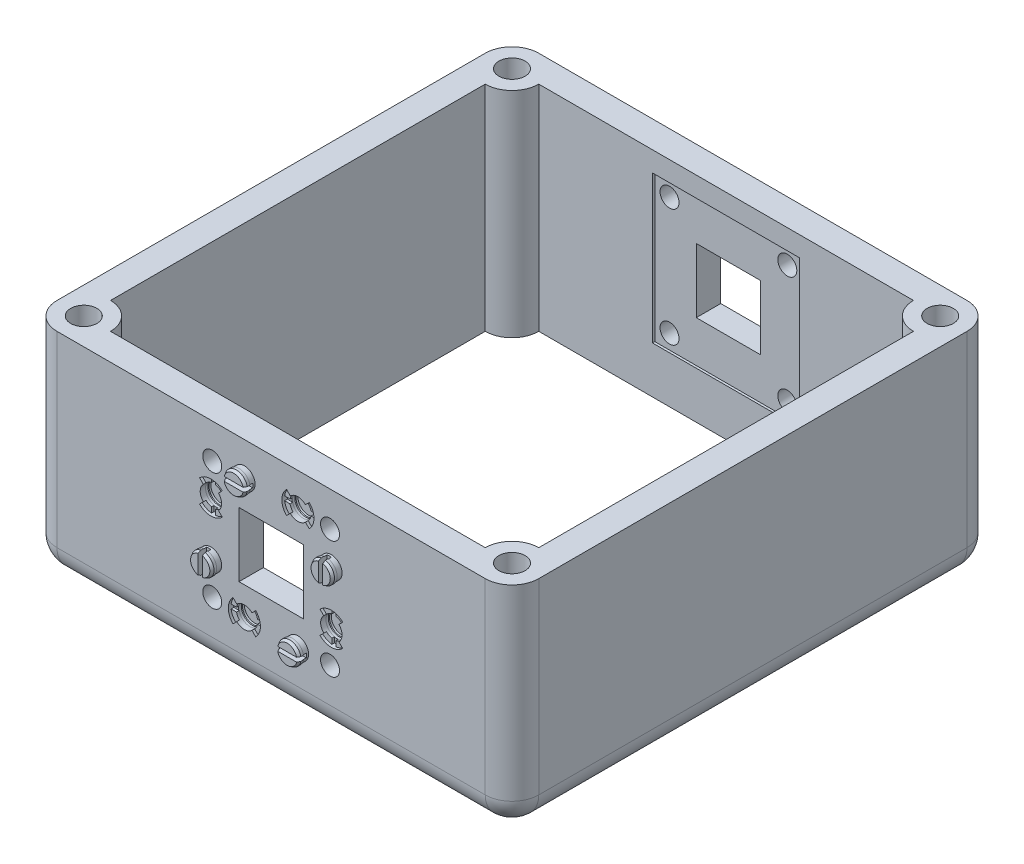
from build123d import *

# Parameters (mm, degrees)
SKETCH1_W                                           = 114.3
SKETCH1_H                                           = 114.3
BOSS_EXTRUDE1_DEPTH                                 = 25.4
CUT_EXTRUDE1_DEPTH                                  = 50.8
CBORE_FOR_0_BINDING_HEAD_MACHINE_SCREW1_D           = 1.8542
CBORE_FOR_0_BINDING_HEAD_MACHINE_SCREW1_DEPTH       = 17.73094212
CBORE_FOR_0_BINDING_HEAD_MACHINE_SCREW1_CBORE_D     = 6.223
CBORE_FOR_0_BINDING_HEAD_MACHINE_SCREW1_CBORE_DEPTH = 9.144
CBORE_FOR_0_BINDING_HEAD_MACHINE_SCREW1_TIP         = 0.55705788
SKETCH5_W                                           = 34.94
SKETCH5_H                                           = 34.94
SKETCH5_W_2                                         = 15.25
SKETCH5_H_2                                         = 15.25
CUT_EXTRUDE5_DEPTH                                  = 0.55
CUT_EXTRUDE6_REACH                                  = 126.758
SKETCH5_3_W                                         = 15.25
SKETCH5_3_H                                         = 15.25
SKETCH13_R                                          = 2.54
BOSS_EXTRUDE2_DEPTH                                 = 1.27
CUT_EXTRUDE7_DEPTH                                  = 2.54
CUT_EXTRUDE8_DEPTH                                  = 0.635
CUT_EXTRUDE9_DEPTH                                  = 1.27
CBORE_FOR_M5_HEX_HEAD_BOLT2_AT_2_COUNT              = 2
CBORE_FOR_M5_HEX_HEAD_BOLT2_AT_2_PITCH              = 27.94
CBORE_FOR_M5_HEX_HEAD_BOLT2_AT_3_COUNT              = 2
CBORE_FOR_M5_HEX_HEAD_BOLT2_AT_3_PITCH              = 39.513126933
CBORE_FOR_M5_HEX_HEAD_BOLT2_AT_4_COUNT              = 2
CBORE_FOR_M5_HEX_HEAD_BOLT2_AT_4_PITCH              = 27.94
CUT_EXTRUDE10_START                                 = -2.032
CUT_EXTRUDE10_DEPTH                                 = 2.032
CIRPATTERN1_COUNT                                   = 4
CIRPATTERN2_COUNT                                   = 2
CIRPATTERN2_ANGLE                                   = 180
CIRPATTERN2_COPY_1_SKETCH_R                         = 2.54
CIRPATTERN2_COPY_1_DEPTH                            = 1.27
CIRPATTERN2_COPY_2_SKETCH_R                         = 2.54
CIRPATTERN2_COPY_2_DEPTH                            = 1.27
CIRPATTERN2_COPY_3_SKETCH_R                         = 2.54
CIRPATTERN2_COPY_3_DEPTH                            = 1.27
CIRPATTERN2_COPY_7_DEPTH                            = 2.54
CIRPATTERN2_COPY_8_DEPTH                            = 2.54
CIRPATTERN2_COPY_9_DEPTH                            = 2.54
CIRPATTERN2_COPY_10_DEPTH                           = 0.635
CIRPATTERN2_COPY_11_DEPTH                           = 0.635
CIRPATTERN2_COPY_12_DEPTH                           = 0.635
CIRPATTERN2_COPY_13_DEPTH                           = 1.27
CIRPATTERN2_COPY_14_DEPTH                           = 1.27
CIRPATTERN2_COPY_15_DEPTH                           = 1.27
CIRPATTERN2_START                                   = -2.032
CIRPATTERN2_COPY_19_DEPTH                           = 2.032
CIRPATTERN2_COPY_20_DEPTH                           = 2.032
CIRPATTERN2_COPY_21_DEPTH                           = 2.032
CIRPATTERN3_COUNT                                   = 2
CIRPATTERN3_ANGLE                                   = 180
FILLET1_R                                           = 6.35


with BuildPart() as part:
    # Sketch1 → Boss-Extrude1 (new, symmetric)
    with BuildSketch(Plane(origin=(0, 0, 0), x_dir=(1, 0, 0), z_dir=(0, 1, 0))):
        Rectangle(SKETCH1_W, SKETCH1_H)
    extrude(amount=BOSS_EXTRUDE1_DEPTH, both=True)

    # Sketch2 → Cut-Extrude1 (cut)
    with BuildSketch(Plane(origin=(0, 25.4, 0), x_dir=(1, 0, 0), z_dir=(0, 1, 0))):
        with BuildLine():
            Line((44.45, 50.8), (-44.45, 50.8))
            ThreePointArc((-44.45, 50.8), (-46.309871939, 46.309871939), (-50.8, 44.45))
            Line((-50.8, 44.45), (-50.8, -44.45))
            ThreePointArc((-50.8, -44.45), (-46.309871939, -46.309871939), (-44.45, -50.8))
            Line((-44.45, -50.8), (44.45, -50.8))
            ThreePointArc((44.45, -50.8), (46.309871939, -46.309871939), (50.8, -44.45))
            Line((50.8, -44.45), (50.8, 44.45))
            ThreePointArc((50.8, 44.45), (46.309871939, 46.309871939), (44.45, 50.8))
        make_face()
    extrude(amount=-CUT_EXTRUDE1_DEPTH, mode=Mode.SUBTRACT)

    # CBORE for #0 Binding Head Machine Screw1
    with Locations(Plane(origin=(-50.8, 25.4, -50.8), x_dir=(0, 0, 1), z_dir=(0, 1, 0))):
        with Locations((0, 0), (0, 101.6), (101.6, 0), (101.6, 101.6)):
            CounterBoreHole(CBORE_FOR_0_BINDING_HEAD_MACHINE_SCREW1_D / 2, CBORE_FOR_0_BINDING_HEAD_MACHINE_SCREW1_CBORE_D / 2, CBORE_FOR_0_BINDING_HEAD_MACHINE_SCREW1_CBORE_DEPTH, depth=CBORE_FOR_0_BINDING_HEAD_MACHINE_SCREW1_DEPTH)
            with Locations((0, 0, -(CBORE_FOR_0_BINDING_HEAD_MACHINE_SCREW1_DEPTH + CBORE_FOR_0_BINDING_HEAD_MACHINE_SCREW1_TIP / 2))):  # 118° drill point
                Cone(0, CBORE_FOR_0_BINDING_HEAD_MACHINE_SCREW1_D / 2, CBORE_FOR_0_BINDING_HEAD_MACHINE_SCREW1_TIP, mode=Mode.SUBTRACT)

    # Sketch5 → Cut-Extrude5 (cut)
    with BuildSketch(Plane.XY.offset(-50.8)):
        with Locations((0, 3.175)):
            Rectangle(SKETCH5_W, SKETCH5_H)
        with Locations((0, 3.175)):
            Rectangle(SKETCH5_W_2, SKETCH5_H_2, mode=Mode.SUBTRACT)
    cut_extrude5 = extrude(amount=-CUT_EXTRUDE5_DEPTH, mode=Mode.SUBTRACT)

    # Sketch5<3> → Cut-Extrude6 (cut, up to next)
    with BuildSketch(Plane.XY.offset(-50.8), mode=Mode.PRIVATE) as cut_extrude6_sk1:
        with Locations((0, 3.175)):
            Rectangle(SKETCH5_3_W, SKETCH5_3_H)
    cut_extrude6_tool1 = extrude(cut_extrude6_sk1.sketch, amount=-CUT_EXTRUDE6_REACH, mode=Mode.PRIVATE) & part.part
    cut_extrude6 = cut_extrude6_tool1.solids().sort_by_distance((0, 3.175, -50.8))[0]
    add(cut_extrude6, mode=Mode.SUBTRACT)

    # Sketch13 → Boss-Extrude2 (add)
    with BuildSketch(Plane(origin=(0, 0, -57.15), x_dir=(-1, 0, 0), z_dir=(0, 0, -1))):
        with Locations(Location((-14.2875, -3.175, 0), (0, 0, 180))):
            Circle(SKETCH13_R)
    boss_extrude2 = extrude(amount=BOSS_EXTRUDE2_DEPTH)

    # Sketch14 → Revolve1 (revolve)
    with BuildSketch(Plane(origin=(14.2875, -3.175, -57.15), x_dir=(-1, 0, 0), z_dir=(0, -1, 0)), mode=Mode.PRIVATE) as revolve1_sk:
        Polygon((0, 1.27), (0, 2.54), (2.286, 2.54), (2.64, 1.905), (2.64, 1.27), (2.54, 1.27), align=None)
    revolve1 = revolve(revolve1_sk.sketch.rotate(Axis((14.2875, -3.175, -58.42), (0, 0, -1)), 180), axis=Axis((14.2875, -3.175, -58.42), (0, 0, -1)))

    # Sketch13<4> → Cut-Extrude7 (cut)
    with BuildSketch(Plane(origin=(0, 0, -57.15), x_dir=(-1, 0, 0), z_dir=(0, 0, -1))):
        with BuildLine():
            Line((16.083551224, -1.378948776), (14.7875, -2.675))
            Line((14.7875, -2.675), (14.7875, -3.675))
            Line((14.7875, -3.675), (16.083551224, -4.971051224))
            ThreePointArc((16.083551224, -4.971051224), (16.634154013, -4.147015918), (16.8275, -3.175))
            ThreePointArc((16.8275, -3.175), (16.634154013, -2.202984082), (16.083551224, -1.378948776))
        make_face()
        with BuildLine():
            Line((16.083551224, -4.971051224), (14.7875, -3.675))
            Line((14.7875, -3.675), (14.7875, -5.665301187))
            ThreePointArc((14.7875, -5.665301187), (15.486857561, -5.414004565), (16.083551224, -4.971051224))
        make_face()
        with BuildLine():
            ThreePointArc((14.7875, -0.684698813), (14.2875, -0.635), (13.7875, -0.684698813))
            Line((13.7875, -0.684698813), (13.7875, -2.675))
            Line((13.7875, -2.675), (14.2875, -3.175))
            Line((14.2875, -3.175), (14.7875, -2.675))
            Line((14.7875, -2.675), (14.7875, -0.684698813))
        make_face()
        with BuildLine():
            Line((14.2875, -3.175), (13.7875, -3.675))
            Line((13.7875, -3.675), (13.7875, -5.665301187))
            ThreePointArc((13.7875, -5.665301187), (14.2875, -5.715), (14.7875, -5.665301187))
            Line((14.7875, -5.665301187), (14.7875, -3.675))
            Line((14.7875, -3.675), (14.2875, -3.175))
        make_face()
        with BuildLine():
            ThreePointArc((16.083551224, -1.378948776), (15.486857561, -0.935995435), (14.7875, -0.684698813))
            Line((14.7875, -0.684698813), (14.7875, -2.675))
            Line((14.7875, -2.675), (16.083551224, -1.378948776))
        make_face()
        Polygon((14.7875, -2.675), (14.2875, -3.175), (14.7875, -3.675), align=None)
        Polygon((14.2875, -3.175), (13.7875, -2.675), (13.7875, -3.675), align=None)
        with BuildLine():
            Line((13.7875, -3.675), (13.7875, -2.675))
            Line((13.7875, -2.675), (12.491448776, -1.378948776))
            ThreePointArc((12.491448776, -1.378948776), (11.7475, -3.175), (12.491448776, -4.971051224))
            Line((12.491448776, -4.971051224), (13.7875, -3.675))
        make_face()
        with BuildLine():
            Line((13.7875, -5.665301187), (13.7875, -3.675))
            Line((13.7875, -3.675), (12.491448776, -4.971051224))
            ThreePointArc((12.491448776, -4.971051224), (13.088142439, -5.414004565), (13.7875, -5.665301187))
        make_face()
        with BuildLine():
            Line((13.7875, -2.675), (13.7875, -0.684698813))
            ThreePointArc((13.7875, -0.684698813), (13.088142439, -0.935995435), (12.491448776, -1.378948776))
            Line((12.491448776, -1.378948776), (13.7875, -2.675))
        make_face()
    cut_extrude7 = extrude(amount=-CUT_EXTRUDE7_DEPTH, mode=Mode.SUBTRACT)

    # Sketch13<5> → Cut-Extrude8 (cut)
    with BuildSketch(Plane(origin=(0, 0, -57.15), x_dir=(-1, 0, 0), z_dir=(0, 0, -1))):
        with BuildLine():
            Line((12.491448776, -4.971051224), (11.593423164, -5.869076836))
            ThreePointArc((11.593423164, -5.869076836), (12.601161082, -6.591483726), (13.7875, -6.952049113))
            Line((13.7875, -6.952049113), (13.7875, -5.665301187))
            ThreePointArc((13.7875, -5.665301187), (13.088142439, -5.414004565), (12.491448776, -4.971051224))
        make_face()
        with BuildLine():
            ThreePointArc((14.7875, -6.952049113), (15.973838918, -6.591483726), (16.981576836, -5.869076836))
            Line((16.981576836, -5.869076836), (16.083551224, -4.971051224))
            ThreePointArc((16.083551224, -4.971051224), (15.486857561, -5.414004565), (14.7875, -5.665301187))
            Line((14.7875, -5.665301187), (14.7875, -6.952049113))
        make_face()
        with BuildLine():
            ThreePointArc((16.981576836, -0.480923164), (15.973838918, 0.241483726), (14.7875, 0.602049113))
            Line((14.7875, 0.602049113), (14.7875, -0.684698813))
            ThreePointArc((14.7875, -0.684698813), (15.486857561, -0.935995435), (16.083551224, -1.378948776))
            Line((16.083551224, -1.378948776), (16.981576836, -0.480923164))
        make_face()
        with BuildLine():
            Line((13.7875, -0.684698813), (13.7875, 0.602049113))
            ThreePointArc((13.7875, 0.602049113), (12.601161082, 0.241483726), (11.593423164, -0.480923164))
            Line((11.593423164, -0.480923164), (12.491448776, -1.378948776))
            ThreePointArc((12.491448776, -1.378948776), (13.088142439, -0.935995435), (13.7875, -0.684698813))
        make_face()
    cut_extrude8 = extrude(amount=-CUT_EXTRUDE8_DEPTH, mode=Mode.SUBTRACT)

    # Sketch13<6> → Cut-Extrude9 (cut)
    with BuildSketch(Plane(origin=(0, 0, -57.15), x_dir=(-1, 0, 0), z_dir=(0, 0, -1))):
        with BuildLine():
            ThreePointArc((14.7875, 0.602049113), (14.2875, 0.635), (13.7875, 0.602049113))
            Line((13.7875, 0.602049113), (13.7875, -0.684698813))
            ThreePointArc((13.7875, -0.684698813), (14.2875, -0.635), (14.7875, -0.684698813))
            Line((14.7875, -0.684698813), (14.7875, 0.602049113))
        make_face()
        with BuildLine():
            Line((13.7875, -5.665301187), (13.7875, -6.952049113))
            ThreePointArc((13.7875, -6.952049113), (14.2875, -6.985), (14.7875, -6.952049113))
            Line((14.7875, -6.952049113), (14.7875, -5.665301187))
            ThreePointArc((14.7875, -5.665301187), (14.2875, -5.715), (13.7875, -5.665301187))
        make_face()
    cut_extrude9 = extrude(amount=-CUT_EXTRUDE9_DEPTH, mode=Mode.SUBTRACT)

    # Sketch17 → Cut-Revolve1 (revolve, cut)
    with BuildSketch(Plane(origin=(-14.2875, -3.175, -57.15), x_dir=(-1, 0, 0), z_dir=(0, -1, 0))):
        Polygon((0, -1.27), (0, -2.54), (2.286, -2.54), (2.64, -1.905), (2.64, -1.27), (2.54, -1.27), align=None)
    cut_revolve1 = revolve(axis=Axis((-14.2875, -3.175, -55.88), (0, 0, 1)), mode=Mode.SUBTRACT)

    # Sketch21 → CBORE for M5 Hex Head Bolt2 (revolve, cut)
    with BuildSketch(Plane(origin=(13.97, 17.145, -57.15), x_dir=(0, 1, 0), z_dir=(1, 0, 0))):
        Polygon((0, 0), (0, 18.288), (2.75, 16.635633298), (2.75, 5.8), (2.25, 5.8), (2.25, 0), align=None)
    cbore_for_m5_hex_head_bolt2 = revolve(axis=Axis((13.97, 17.145, -63.5), (0, 0, 1)), mode=Mode.SUBTRACT)

    # CBORE for M5 Hex Head Bolt2 at 2: CBORE for M5 Hex Head Bolt2 ×2
    with Locations(*[(-i * CBORE_FOR_M5_HEX_HEAD_BOLT2_AT_2_PITCH, 0, 0) for i in range(1, CBORE_FOR_M5_HEX_HEAD_BOLT2_AT_2_COUNT)]):
        add(cbore_for_m5_hex_head_bolt2, mode=Mode.SUBTRACT)

    # CBORE for M5 Hex Head Bolt2 at 3: CBORE for M5 Hex Head Bolt2 ×2
    with Locations(*[Vector(-0.7071067811865476, -0.7071067811865476, 0) * (i * CBORE_FOR_M5_HEX_HEAD_BOLT2_AT_3_PITCH) for i in range(1, CBORE_FOR_M5_HEX_HEAD_BOLT2_AT_3_COUNT)]):
        add(cbore_for_m5_hex_head_bolt2, mode=Mode.SUBTRACT)

    # CBORE for M5 Hex Head Bolt2 at 4: CBORE for M5 Hex Head Bolt2 ×2
    with Locations(*[(0, -i * CBORE_FOR_M5_HEX_HEAD_BOLT2_AT_4_PITCH, 0) for i in range(1, CBORE_FOR_M5_HEX_HEAD_BOLT2_AT_4_COUNT)]):
        add(cbore_for_m5_hex_head_bolt2, mode=Mode.SUBTRACT)

    # Sketch23 → Cut-Extrude10 (cut)
    with BuildSketch(Plane(origin=(0, 0, -59.69), x_dir=(-1, 0, 0), z_dir=(0, 0, -1)).offset(CUT_EXTRUDE10_START)):
        with BuildLine():
            ThreePointArc((-14.2875, -0.889), (-14.539027189, -0.902879829), (-14.7875, -0.944350767))
            Line((-14.7875, -0.944350767), (-14.7875, -5.405649233))
            ThreePointArc((-14.7875, -5.405649233), (-14.539027189, -5.447120171), (-14.2875, -5.461))
            Line((-14.2875, -5.461), (-14.2875, -0.889))
        make_face()
        with BuildLine():
            ThreePointArc((-13.7875, -0.944350767), (-14.035972811, -0.902879829), (-14.2875, -0.889))
            Line((-14.2875, -0.889), (-14.2875, -5.461))
            ThreePointArc((-14.2875, -5.461), (-14.035972811, -5.447120171), (-13.7875, -5.405649233))
            Line((-13.7875, -5.405649233), (-13.7875, -0.944350767))
        make_face()
        with BuildLine():
            ThreePointArc((-14.2875, -0.535), (-14.538638912, -0.546972366), (-14.7875, -0.582780873))
            Line((-14.7875, -0.582780873), (-14.7875, -0.944350767))
            ThreePointArc((-14.7875, -0.944350767), (-14.539027189, -0.902879829), (-14.2875, -0.889))
            Line((-14.2875, -0.889), (-14.2875, -0.535))
        make_face()
        with BuildLine():
            Line((-14.7875, -5.405649233), (-14.7875, -5.767219127))
            ThreePointArc((-14.7875, -5.767219127), (-14.538638912, -5.803027634), (-14.2875, -5.815))
            Line((-14.2875, -5.815), (-14.2875, -5.461))
            ThreePointArc((-14.2875, -5.461), (-14.539027189, -5.447120171), (-14.7875, -5.405649233))
        make_face()
        with BuildLine():
            ThreePointArc((-13.7875, -0.582780873), (-14.036361088, -0.546972366), (-14.2875, -0.535))
            Line((-14.2875, -0.535), (-14.2875, -0.889))
            ThreePointArc((-14.2875, -0.889), (-14.035972811, -0.902879829), (-13.7875, -0.944350767))
            Line((-13.7875, -0.944350767), (-13.7875, -0.582780873))
        make_face()
        with BuildLine():
            Line((-14.2875, -5.461), (-14.2875, -5.815))
            ThreePointArc((-14.2875, -5.815), (-14.036361088, -5.803027634), (-13.7875, -5.767219127))
            Line((-13.7875, -5.767219127), (-13.7875, -5.405649233))
            ThreePointArc((-13.7875, -5.405649233), (-14.035972811, -5.447120171), (-14.2875, -5.461))
        make_face()
    cut_extrude10 = extrude(amount=CUT_EXTRUDE10_DEPTH, mode=Mode.SUBTRACT)

    # CirPattern1: Boss-Extrude2, Revolve1, Cut-Extrude7, Cut-Extrude8, Cut-Extrude9, Cut-Revolve1, Cut-Extrude10 ×4 about axis
    cirpattern1_axis = Axis((0, 3.175, 0), (0, 0, 1))
    add([boss_extrude2.rotate(cirpattern1_axis, i * 360 / CIRPATTERN1_COUNT) for i in range(1, CIRPATTERN1_COUNT)])
    add([revolve1.rotate(cirpattern1_axis, i * 360 / CIRPATTERN1_COUNT) for i in range(1, CIRPATTERN1_COUNT)])
    add([cut_extrude7.rotate(cirpattern1_axis, i * 360 / CIRPATTERN1_COUNT) for i in range(1, CIRPATTERN1_COUNT)], mode=Mode.SUBTRACT)
    add([cut_extrude8.rotate(cirpattern1_axis, i * 360 / CIRPATTERN1_COUNT) for i in range(1, CIRPATTERN1_COUNT)], mode=Mode.SUBTRACT)
    add([cut_extrude9.rotate(cirpattern1_axis, i * 360 / CIRPATTERN1_COUNT) for i in range(1, CIRPATTERN1_COUNT)], mode=Mode.SUBTRACT)
    add([cut_revolve1.rotate(cirpattern1_axis, i * 360 / CIRPATTERN1_COUNT) for i in range(1, CIRPATTERN1_COUNT)], mode=Mode.SUBTRACT)
    add([cut_extrude10.rotate(cirpattern1_axis, i * 360 / CIRPATTERN1_COUNT) for i in range(1, CIRPATTERN1_COUNT)], mode=Mode.SUBTRACT)

    # CirPattern2: Boss-Extrude2, Revolve1, Cut-Extrude7, Cut-Extrude8, Cut-Extrude9, Cut-Revolve1, Cut-Extrude10 ×2 about axis
    cirpattern2_axis = Axis((0, 3.175, 0), (1, 0, 0))
    add([boss_extrude2.rotate(cirpattern2_axis, i * CIRPATTERN2_ANGLE / (CIRPATTERN2_COUNT - 1)) for i in range(1, CIRPATTERN2_COUNT)])
    add([revolve1.rotate(cirpattern2_axis, i * CIRPATTERN2_ANGLE / (CIRPATTERN2_COUNT - 1)) for i in range(1, CIRPATTERN2_COUNT)])
    add([cut_extrude7.rotate(cirpattern2_axis, i * CIRPATTERN2_ANGLE / (CIRPATTERN2_COUNT - 1)) for i in range(1, CIRPATTERN2_COUNT)], mode=Mode.SUBTRACT)
    add([cut_extrude8.rotate(cirpattern2_axis, i * CIRPATTERN2_ANGLE / (CIRPATTERN2_COUNT - 1)) for i in range(1, CIRPATTERN2_COUNT)], mode=Mode.SUBTRACT)
    add([cut_extrude9.rotate(cirpattern2_axis, i * CIRPATTERN2_ANGLE / (CIRPATTERN2_COUNT - 1)) for i in range(1, CIRPATTERN2_COUNT)], mode=Mode.SUBTRACT)
    add([cut_revolve1.rotate(cirpattern2_axis, i * CIRPATTERN2_ANGLE / (CIRPATTERN2_COUNT - 1)) for i in range(1, CIRPATTERN2_COUNT)], mode=Mode.SUBTRACT)
    add([cut_extrude10.rotate(cirpattern2_axis, i * CIRPATTERN2_ANGLE / (CIRPATTERN2_COUNT - 1)) for i in range(1, CIRPATTERN2_COUNT)], mode=Mode.SUBTRACT)

    # CirPattern2 copy 1 sketch → CirPattern2 copy 1 (add)
    with BuildSketch(Plane(origin=(3.175, 3.175, 57.15), x_dir=(0, 1, 0), z_dir=(0, 0, 1))):
        with Locations(Location((-14.2875, -3.175, 0), (0, 0, 180))):
            Circle(CIRPATTERN2_COPY_1_SKETCH_R)
    extrude(amount=CIRPATTERN2_COPY_1_DEPTH)

    # CirPattern2 copy 2 sketch → CirPattern2 copy 2 (add)
    with BuildSketch(Plane.XY.offset(57.15)):
        with Locations(Location((-14.2875, -3.175, 0), (0, 0, 180))):
            Circle(CIRPATTERN2_COPY_2_SKETCH_R)
    extrude(amount=CIRPATTERN2_COPY_2_DEPTH)

    # CirPattern2 copy 3 sketch → CirPattern2 copy 3 (add)
    with BuildSketch(Plane(origin=(-3.175, 3.175, 57.15), x_dir=(0, -1, 0), z_dir=(0, 0, 1))):
        with Locations(Location((-14.2875, -3.175, 0), (0, 0, 180))):
            Circle(CIRPATTERN2_COPY_3_SKETCH_R)
    extrude(amount=CIRPATTERN2_COPY_3_DEPTH)

    # CirPattern2 copy 4 sketch → CirPattern2 copy 4 (revolve)
    with BuildSketch(Plane(origin=(6.35, -11.1125, 57.15), x_dir=(0, 1, 0), z_dir=(1, 0, 0))):
        Polygon((0, 1.27), (0, 2.54), (2.286, 2.54), (2.64, 1.905), (2.64, 1.27), (2.54, 1.27), align=None)
    revolve(axis=Axis((6.35, -11.1125, 58.42), (0, 0, 1)))

    # CirPattern2 copy 5 sketch → CirPattern2 copy 5 (revolve)
    with BuildSketch(Plane(origin=(-14.2875, -3.175, 57.15), x_dir=(1, 0, 0), z_dir=(0, -1, 0))):
        Polygon((0, 1.27), (0, 2.54), (2.286, 2.54), (2.64, 1.905), (2.64, 1.27), (2.54, 1.27), align=None)
    revolve(axis=Axis((-14.2875, -3.175, 58.42), (0, 0, 1)))

    # CirPattern2 copy 6 sketch → CirPattern2 copy 6 (revolve)
    with BuildSketch(Plane(origin=(-6.35, 17.4625, 57.15), x_dir=(0, -1, 0), z_dir=(-1, 0, 0))):
        Polygon((0, 1.27), (0, 2.54), (2.286, 2.54), (2.64, 1.905), (2.64, 1.27), (2.54, 1.27), align=None)
    revolve(axis=Axis((-6.35, 17.4625, 58.42), (0, 0, 1)))

    # CirPattern2 copy 7 sketch → CirPattern2 copy 7 (cut)
    with BuildSketch(Plane(origin=(3.175, 3.175, 57.15), x_dir=(0, 1, 0), z_dir=(0, 0, 1))):
        with BuildLine():
            Line((16.083551224, -1.378948776), (14.7875, -2.675))
            Line((14.7875, -2.675), (14.7875, -3.675))
            Line((14.7875, -3.675), (16.083551224, -4.971051224))
            ThreePointArc((16.083551224, -4.971051224), (16.634154013, -4.147015918), (16.8275, -3.175))
            ThreePointArc((16.8275, -3.175), (16.634154013, -2.202984082), (16.083551224, -1.378948776))
        make_face()
        with BuildLine():
            Line((16.083551224, -4.971051224), (14.7875, -3.675))
            Line((14.7875, -3.675), (14.7875, -5.665301187))
            ThreePointArc((14.7875, -5.665301187), (15.486857561, -5.414004565), (16.083551224, -4.971051224))
        make_face()
        with BuildLine():
            ThreePointArc((14.7875, -0.684698813), (14.2875, -0.635), (13.7875, -0.684698813))
            Line((13.7875, -0.684698813), (13.7875, -2.675))
            Line((13.7875, -2.675), (14.2875, -3.175))
            Line((14.2875, -3.175), (14.7875, -2.675))
            Line((14.7875, -2.675), (14.7875, -0.684698813))
        make_face()
        with BuildLine():
            Line((14.2875, -3.175), (13.7875, -3.675))
            Line((13.7875, -3.675), (13.7875, -5.665301187))
            ThreePointArc((13.7875, -5.665301187), (14.2875, -5.715), (14.7875, -5.665301187))
            Line((14.7875, -5.665301187), (14.7875, -3.675))
            Line((14.7875, -3.675), (14.2875, -3.175))
        make_face()
        with BuildLine():
            ThreePointArc((16.083551224, -1.378948776), (15.486857561, -0.935995435), (14.7875, -0.684698813))
            Line((14.7875, -0.684698813), (14.7875, -2.675))
            Line((14.7875, -2.675), (16.083551224, -1.378948776))
        make_face()
        Polygon((14.7875, -2.675), (14.2875, -3.175), (14.7875, -3.675), align=None)
        Polygon((14.2875, -3.175), (13.7875, -2.675), (13.7875, -3.675), align=None)
        with BuildLine():
            Line((13.7875, -3.675), (13.7875, -2.675))
            Line((13.7875, -2.675), (12.491448776, -1.378948776))
            ThreePointArc((12.491448776, -1.378948776), (11.7475, -3.175), (12.491448776, -4.971051224))
            Line((12.491448776, -4.971051224), (13.7875, -3.675))
        make_face()
        with BuildLine():
            Line((13.7875, -5.665301187), (13.7875, -3.675))
            Line((13.7875, -3.675), (12.491448776, -4.971051224))
            ThreePointArc((12.491448776, -4.971051224), (13.088142439, -5.414004565), (13.7875, -5.665301187))
        make_face()
        with BuildLine():
            Line((13.7875, -2.675), (13.7875, -0.684698813))
            ThreePointArc((13.7875, -0.684698813), (13.088142439, -0.935995435), (12.491448776, -1.378948776))
            Line((12.491448776, -1.378948776), (13.7875, -2.675))
        make_face()
    extrude(amount=-CIRPATTERN2_COPY_7_DEPTH, mode=Mode.SUBTRACT)

    # CirPattern2 copy 8 sketch → CirPattern2 copy 8 (cut)
    with BuildSketch(Plane.XY.offset(57.15)):
        with BuildLine():
            Line((16.083551224, -1.378948776), (14.7875, -2.675))
            Line((14.7875, -2.675), (14.7875, -3.675))
            Line((14.7875, -3.675), (16.083551224, -4.971051224))
            ThreePointArc((16.083551224, -4.971051224), (16.634154013, -4.147015918), (16.8275, -3.175))
            ThreePointArc((16.8275, -3.175), (16.634154013, -2.202984082), (16.083551224, -1.378948776))
        make_face()
        with BuildLine():
            Line((16.083551224, -4.971051224), (14.7875, -3.675))
            Line((14.7875, -3.675), (14.7875, -5.665301187))
            ThreePointArc((14.7875, -5.665301187), (15.486857561, -5.414004565), (16.083551224, -4.971051224))
        make_face()
        with BuildLine():
            ThreePointArc((14.7875, -0.684698813), (14.2875, -0.635), (13.7875, -0.684698813))
            Line((13.7875, -0.684698813), (13.7875, -2.675))
            Line((13.7875, -2.675), (14.2875, -3.175))
            Line((14.2875, -3.175), (14.7875, -2.675))
            Line((14.7875, -2.675), (14.7875, -0.684698813))
        make_face()
        with BuildLine():
            Line((14.2875, -3.175), (13.7875, -3.675))
            Line((13.7875, -3.675), (13.7875, -5.665301187))
            ThreePointArc((13.7875, -5.665301187), (14.2875, -5.715), (14.7875, -5.665301187))
            Line((14.7875, -5.665301187), (14.7875, -3.675))
            Line((14.7875, -3.675), (14.2875, -3.175))
        make_face()
        with BuildLine():
            ThreePointArc((16.083551224, -1.378948776), (15.486857561, -0.935995435), (14.7875, -0.684698813))
            Line((14.7875, -0.684698813), (14.7875, -2.675))
            Line((14.7875, -2.675), (16.083551224, -1.378948776))
        make_face()
        Polygon((14.7875, -2.675), (14.2875, -3.175), (14.7875, -3.675), align=None)
        Polygon((14.2875, -3.175), (13.7875, -2.675), (13.7875, -3.675), align=None)
        with BuildLine():
            Line((13.7875, -3.675), (13.7875, -2.675))
            Line((13.7875, -2.675), (12.491448776, -1.378948776))
            ThreePointArc((12.491448776, -1.378948776), (11.7475, -3.175), (12.491448776, -4.971051224))
            Line((12.491448776, -4.971051224), (13.7875, -3.675))
        make_face()
        with BuildLine():
            Line((13.7875, -5.665301187), (13.7875, -3.675))
            Line((13.7875, -3.675), (12.491448776, -4.971051224))
            ThreePointArc((12.491448776, -4.971051224), (13.088142439, -5.414004565), (13.7875, -5.665301187))
        make_face()
        with BuildLine():
            Line((13.7875, -2.675), (13.7875, -0.684698813))
            ThreePointArc((13.7875, -0.684698813), (13.088142439, -0.935995435), (12.491448776, -1.378948776))
            Line((12.491448776, -1.378948776), (13.7875, -2.675))
        make_face()
    extrude(amount=-CIRPATTERN2_COPY_8_DEPTH, mode=Mode.SUBTRACT)

    # CirPattern2 copy 9 sketch → CirPattern2 copy 9 (cut)
    with BuildSketch(Plane(origin=(-3.175, 3.175, 57.15), x_dir=(0, -1, 0), z_dir=(0, 0, 1))):
        with BuildLine():
            Line((16.083551224, -1.378948776), (14.7875, -2.675))
            Line((14.7875, -2.675), (14.7875, -3.675))
            Line((14.7875, -3.675), (16.083551224, -4.971051224))
            ThreePointArc((16.083551224, -4.971051224), (16.634154013, -4.147015918), (16.8275, -3.175))
            ThreePointArc((16.8275, -3.175), (16.634154013, -2.202984082), (16.083551224, -1.378948776))
        make_face()
        with BuildLine():
            Line((16.083551224, -4.971051224), (14.7875, -3.675))
            Line((14.7875, -3.675), (14.7875, -5.665301187))
            ThreePointArc((14.7875, -5.665301187), (15.486857561, -5.414004565), (16.083551224, -4.971051224))
        make_face()
        with BuildLine():
            ThreePointArc((14.7875, -0.684698813), (14.2875, -0.635), (13.7875, -0.684698813))
            Line((13.7875, -0.684698813), (13.7875, -2.675))
            Line((13.7875, -2.675), (14.2875, -3.175))
            Line((14.2875, -3.175), (14.7875, -2.675))
            Line((14.7875, -2.675), (14.7875, -0.684698813))
        make_face()
        with BuildLine():
            Line((14.2875, -3.175), (13.7875, -3.675))
            Line((13.7875, -3.675), (13.7875, -5.665301187))
            ThreePointArc((13.7875, -5.665301187), (14.2875, -5.715), (14.7875, -5.665301187))
            Line((14.7875, -5.665301187), (14.7875, -3.675))
            Line((14.7875, -3.675), (14.2875, -3.175))
        make_face()
        with BuildLine():
            ThreePointArc((16.083551224, -1.378948776), (15.486857561, -0.935995435), (14.7875, -0.684698813))
            Line((14.7875, -0.684698813), (14.7875, -2.675))
            Line((14.7875, -2.675), (16.083551224, -1.378948776))
        make_face()
        Polygon((14.7875, -2.675), (14.2875, -3.175), (14.7875, -3.675), align=None)
        Polygon((14.2875, -3.175), (13.7875, -2.675), (13.7875, -3.675), align=None)
        with BuildLine():
            Line((13.7875, -3.675), (13.7875, -2.675))
            Line((13.7875, -2.675), (12.491448776, -1.378948776))
            ThreePointArc((12.491448776, -1.378948776), (11.7475, -3.175), (12.491448776, -4.971051224))
            Line((12.491448776, -4.971051224), (13.7875, -3.675))
        make_face()
        with BuildLine():
            Line((13.7875, -5.665301187), (13.7875, -3.675))
            Line((13.7875, -3.675), (12.491448776, -4.971051224))
            ThreePointArc((12.491448776, -4.971051224), (13.088142439, -5.414004565), (13.7875, -5.665301187))
        make_face()
        with BuildLine():
            Line((13.7875, -2.675), (13.7875, -0.684698813))
            ThreePointArc((13.7875, -0.684698813), (13.088142439, -0.935995435), (12.491448776, -1.378948776))
            Line((12.491448776, -1.378948776), (13.7875, -2.675))
        make_face()
    extrude(amount=-CIRPATTERN2_COPY_9_DEPTH, mode=Mode.SUBTRACT)

    # CirPattern2 copy 10 sketch → CirPattern2 copy 10 (cut)
    with BuildSketch(Plane(origin=(3.175, 3.175, 57.15), x_dir=(0, 1, 0), z_dir=(0, 0, 1))):
        with BuildLine():
            Line((12.491448776, -4.971051224), (11.593423164, -5.869076836))
            ThreePointArc((11.593423164, -5.869076836), (12.601161082, -6.591483726), (13.7875, -6.952049113))
            Line((13.7875, -6.952049113), (13.7875, -5.665301187))
            ThreePointArc((13.7875, -5.665301187), (13.088142439, -5.414004565), (12.491448776, -4.971051224))
        make_face()
        with BuildLine():
            ThreePointArc((14.7875, -6.952049113), (15.973838918, -6.591483726), (16.981576836, -5.869076836))
            Line((16.981576836, -5.869076836), (16.083551224, -4.971051224))
            ThreePointArc((16.083551224, -4.971051224), (15.486857561, -5.414004565), (14.7875, -5.665301187))
            Line((14.7875, -5.665301187), (14.7875, -6.952049113))
        make_face()
        with BuildLine():
            ThreePointArc((16.981576836, -0.480923164), (15.973838918, 0.241483726), (14.7875, 0.602049113))
            Line((14.7875, 0.602049113), (14.7875, -0.684698813))
            ThreePointArc((14.7875, -0.684698813), (15.486857561, -0.935995435), (16.083551224, -1.378948776))
            Line((16.083551224, -1.378948776), (16.981576836, -0.480923164))
        make_face()
        with BuildLine():
            Line((13.7875, -0.684698813), (13.7875, 0.602049113))
            ThreePointArc((13.7875, 0.602049113), (12.601161082, 0.241483726), (11.593423164, -0.480923164))
            Line((11.593423164, -0.480923164), (12.491448776, -1.378948776))
            ThreePointArc((12.491448776, -1.378948776), (13.088142439, -0.935995435), (13.7875, -0.684698813))
        make_face()
    extrude(amount=-CIRPATTERN2_COPY_10_DEPTH, mode=Mode.SUBTRACT)

    # CirPattern2 copy 11 sketch → CirPattern2 copy 11 (cut)
    with BuildSketch(Plane.XY.offset(57.15)):
        with BuildLine():
            Line((12.491448776, -4.971051224), (11.593423164, -5.869076836))
            ThreePointArc((11.593423164, -5.869076836), (12.601161082, -6.591483726), (13.7875, -6.952049113))
            Line((13.7875, -6.952049113), (13.7875, -5.665301187))
            ThreePointArc((13.7875, -5.665301187), (13.088142439, -5.414004565), (12.491448776, -4.971051224))
        make_face()
        with BuildLine():
            ThreePointArc((14.7875, -6.952049113), (15.973838918, -6.591483726), (16.981576836, -5.869076836))
            Line((16.981576836, -5.869076836), (16.083551224, -4.971051224))
            ThreePointArc((16.083551224, -4.971051224), (15.486857561, -5.414004565), (14.7875, -5.665301187))
            Line((14.7875, -5.665301187), (14.7875, -6.952049113))
        make_face()
        with BuildLine():
            ThreePointArc((16.981576836, -0.480923164), (15.973838918, 0.241483726), (14.7875, 0.602049113))
            Line((14.7875, 0.602049113), (14.7875, -0.684698813))
            ThreePointArc((14.7875, -0.684698813), (15.486857561, -0.935995435), (16.083551224, -1.378948776))
            Line((16.083551224, -1.378948776), (16.981576836, -0.480923164))
        make_face()
        with BuildLine():
            Line((13.7875, -0.684698813), (13.7875, 0.602049113))
            ThreePointArc((13.7875, 0.602049113), (12.601161082, 0.241483726), (11.593423164, -0.480923164))
            Line((11.593423164, -0.480923164), (12.491448776, -1.378948776))
            ThreePointArc((12.491448776, -1.378948776), (13.088142439, -0.935995435), (13.7875, -0.684698813))
        make_face()
    extrude(amount=-CIRPATTERN2_COPY_11_DEPTH, mode=Mode.SUBTRACT)

    # CirPattern2 copy 12 sketch → CirPattern2 copy 12 (cut)
    with BuildSketch(Plane(origin=(-3.175, 3.175, 57.15), x_dir=(0, -1, 0), z_dir=(0, 0, 1))):
        with BuildLine():
            Line((12.491448776, -4.971051224), (11.593423164, -5.869076836))
            ThreePointArc((11.593423164, -5.869076836), (12.601161082, -6.591483726), (13.7875, -6.952049113))
            Line((13.7875, -6.952049113), (13.7875, -5.665301187))
            ThreePointArc((13.7875, -5.665301187), (13.088142439, -5.414004565), (12.491448776, -4.971051224))
        make_face()
        with BuildLine():
            ThreePointArc((14.7875, -6.952049113), (15.973838918, -6.591483726), (16.981576836, -5.869076836))
            Line((16.981576836, -5.869076836), (16.083551224, -4.971051224))
            ThreePointArc((16.083551224, -4.971051224), (15.486857561, -5.414004565), (14.7875, -5.665301187))
            Line((14.7875, -5.665301187), (14.7875, -6.952049113))
        make_face()
        with BuildLine():
            ThreePointArc((16.981576836, -0.480923164), (15.973838918, 0.241483726), (14.7875, 0.602049113))
            Line((14.7875, 0.602049113), (14.7875, -0.684698813))
            ThreePointArc((14.7875, -0.684698813), (15.486857561, -0.935995435), (16.083551224, -1.378948776))
            Line((16.083551224, -1.378948776), (16.981576836, -0.480923164))
        make_face()
        with BuildLine():
            Line((13.7875, -0.684698813), (13.7875, 0.602049113))
            ThreePointArc((13.7875, 0.602049113), (12.601161082, 0.241483726), (11.593423164, -0.480923164))
            Line((11.593423164, -0.480923164), (12.491448776, -1.378948776))
            ThreePointArc((12.491448776, -1.378948776), (13.088142439, -0.935995435), (13.7875, -0.684698813))
        make_face()
    extrude(amount=-CIRPATTERN2_COPY_12_DEPTH, mode=Mode.SUBTRACT)

    # CirPattern2 copy 13 sketch → CirPattern2 copy 13 (cut)
    with BuildSketch(Plane(origin=(3.175, 3.175, 57.15), x_dir=(0, 1, 0), z_dir=(0, 0, 1))):
        with BuildLine():
            ThreePointArc((14.7875, 0.602049113), (14.2875, 0.635), (13.7875, 0.602049113))
            Line((13.7875, 0.602049113), (13.7875, -0.684698813))
            ThreePointArc((13.7875, -0.684698813), (14.2875, -0.635), (14.7875, -0.684698813))
            Line((14.7875, -0.684698813), (14.7875, 0.602049113))
        make_face()
        with BuildLine():
            Line((13.7875, -5.665301187), (13.7875, -6.952049113))
            ThreePointArc((13.7875, -6.952049113), (14.2875, -6.985), (14.7875, -6.952049113))
            Line((14.7875, -6.952049113), (14.7875, -5.665301187))
            ThreePointArc((14.7875, -5.665301187), (14.2875, -5.715), (13.7875, -5.665301187))
        make_face()
    extrude(amount=-CIRPATTERN2_COPY_13_DEPTH, mode=Mode.SUBTRACT)

    # CirPattern2 copy 14 sketch → CirPattern2 copy 14 (cut)
    with BuildSketch(Plane.XY.offset(57.15)):
        with BuildLine():
            ThreePointArc((14.7875, 0.602049113), (14.2875, 0.635), (13.7875, 0.602049113))
            Line((13.7875, 0.602049113), (13.7875, -0.684698813))
            ThreePointArc((13.7875, -0.684698813), (14.2875, -0.635), (14.7875, -0.684698813))
            Line((14.7875, -0.684698813), (14.7875, 0.602049113))
        make_face()
        with BuildLine():
            Line((13.7875, -5.665301187), (13.7875, -6.952049113))
            ThreePointArc((13.7875, -6.952049113), (14.2875, -6.985), (14.7875, -6.952049113))
            Line((14.7875, -6.952049113), (14.7875, -5.665301187))
            ThreePointArc((14.7875, -5.665301187), (14.2875, -5.715), (13.7875, -5.665301187))
        make_face()
    extrude(amount=-CIRPATTERN2_COPY_14_DEPTH, mode=Mode.SUBTRACT)

    # CirPattern2 copy 15 sketch → CirPattern2 copy 15 (cut)
    with BuildSketch(Plane(origin=(-3.175, 3.175, 57.15), x_dir=(0, -1, 0), z_dir=(0, 0, 1))):
        with BuildLine():
            ThreePointArc((14.7875, 0.602049113), (14.2875, 0.635), (13.7875, 0.602049113))
            Line((13.7875, 0.602049113), (13.7875, -0.684698813))
            ThreePointArc((13.7875, -0.684698813), (14.2875, -0.635), (14.7875, -0.684698813))
            Line((14.7875, -0.684698813), (14.7875, 0.602049113))
        make_face()
        with BuildLine():
            Line((13.7875, -5.665301187), (13.7875, -6.952049113))
            ThreePointArc((13.7875, -6.952049113), (14.2875, -6.985), (14.7875, -6.952049113))
            Line((14.7875, -6.952049113), (14.7875, -5.665301187))
            ThreePointArc((14.7875, -5.665301187), (14.2875, -5.715), (13.7875, -5.665301187))
        make_face()
    extrude(amount=-CIRPATTERN2_COPY_15_DEPTH, mode=Mode.SUBTRACT)

    # CirPattern2 copy 16 sketch → CirPattern2 copy 16 (revolve, cut)
    with BuildSketch(Plane(origin=(6.35, 17.4625, 57.15), x_dir=(0, 1, 0), z_dir=(1, 0, 0))):
        Polygon((0, -1.27), (0, -2.54), (2.286, -2.54), (2.64, -1.905), (2.64, -1.27), (2.54, -1.27), align=None)
    revolve(axis=Axis((6.35, 17.4625, 55.88), (0, 0, -1)), mode=Mode.SUBTRACT)

    # CirPattern2 copy 17 sketch → CirPattern2 copy 17 (revolve, cut)
    with BuildSketch(Plane(origin=(14.2875, -3.175, 57.15), x_dir=(1, 0, 0), z_dir=(0, -1, 0))):
        Polygon((0, -1.27), (0, -2.54), (2.286, -2.54), (2.64, -1.905), (2.64, -1.27), (2.54, -1.27), align=None)
    revolve(axis=Axis((14.2875, -3.175, 55.88), (0, 0, -1)), mode=Mode.SUBTRACT)

    # CirPattern2 copy 18 sketch → CirPattern2 copy 18 (revolve, cut)
    with BuildSketch(Plane(origin=(-6.35, -11.1125, 57.15), x_dir=(0, -1, 0), z_dir=(-1, 0, 0))):
        Polygon((0, -1.27), (0, -2.54), (2.286, -2.54), (2.64, -1.905), (2.64, -1.27), (2.54, -1.27), align=None)
    revolve(axis=Axis((-6.35, -11.1125, 55.88), (0, 0, -1)), mode=Mode.SUBTRACT)

    # CirPattern2 copy 19 sketch → CirPattern2 copy 19 (cut)
    with BuildSketch(Plane(origin=(3.175, 3.175, 59.69), x_dir=(0, 1, 0), z_dir=(0, 0, 1)).offset(CIRPATTERN2_START)):
        with BuildLine():
            ThreePointArc((-14.2875, -0.889), (-14.539027189, -0.902879829), (-14.7875, -0.944350767))
            Line((-14.7875, -0.944350767), (-14.7875, -5.405649233))
            ThreePointArc((-14.7875, -5.405649233), (-14.539027189, -5.447120171), (-14.2875, -5.461))
            Line((-14.2875, -5.461), (-14.2875, -0.889))
        make_face()
        with BuildLine():
            ThreePointArc((-13.7875, -0.944350767), (-14.035972811, -0.902879829), (-14.2875, -0.889))
            Line((-14.2875, -0.889), (-14.2875, -5.461))
            ThreePointArc((-14.2875, -5.461), (-14.035972811, -5.447120171), (-13.7875, -5.405649233))
            Line((-13.7875, -5.405649233), (-13.7875, -0.944350767))
        make_face()
        with BuildLine():
            ThreePointArc((-14.2875, -0.535), (-14.538638912, -0.546972366), (-14.7875, -0.582780873))
            Line((-14.7875, -0.582780873), (-14.7875, -0.944350767))
            ThreePointArc((-14.7875, -0.944350767), (-14.539027189, -0.902879829), (-14.2875, -0.889))
            Line((-14.2875, -0.889), (-14.2875, -0.535))
        make_face()
        with BuildLine():
            Line((-14.7875, -5.405649233), (-14.7875, -5.767219127))
            ThreePointArc((-14.7875, -5.767219127), (-14.538638912, -5.803027634), (-14.2875, -5.815))
            Line((-14.2875, -5.815), (-14.2875, -5.461))
            ThreePointArc((-14.2875, -5.461), (-14.539027189, -5.447120171), (-14.7875, -5.405649233))
        make_face()
        with BuildLine():
            ThreePointArc((-13.7875, -0.582780873), (-14.036361088, -0.546972366), (-14.2875, -0.535))
            Line((-14.2875, -0.535), (-14.2875, -0.889))
            ThreePointArc((-14.2875, -0.889), (-14.035972811, -0.902879829), (-13.7875, -0.944350767))
            Line((-13.7875, -0.944350767), (-13.7875, -0.582780873))
        make_face()
        with BuildLine():
            Line((-14.2875, -5.461), (-14.2875, -5.815))
            ThreePointArc((-14.2875, -5.815), (-14.036361088, -5.803027634), (-13.7875, -5.767219127))
            Line((-13.7875, -5.767219127), (-13.7875, -5.405649233))
            ThreePointArc((-13.7875, -5.405649233), (-14.035972811, -5.447120171), (-14.2875, -5.461))
        make_face()
    extrude(amount=CIRPATTERN2_COPY_19_DEPTH, mode=Mode.SUBTRACT)

    # CirPattern2 copy 20 sketch → CirPattern2 copy 20 (cut)
    with BuildSketch(Plane.XY.offset(59.69).offset(CIRPATTERN2_START)):
        with BuildLine():
            ThreePointArc((-14.2875, -0.889), (-14.539027189, -0.902879829), (-14.7875, -0.944350767))
            Line((-14.7875, -0.944350767), (-14.7875, -5.405649233))
            ThreePointArc((-14.7875, -5.405649233), (-14.539027189, -5.447120171), (-14.2875, -5.461))
            Line((-14.2875, -5.461), (-14.2875, -0.889))
        make_face()
        with BuildLine():
            ThreePointArc((-13.7875, -0.944350767), (-14.035972811, -0.902879829), (-14.2875, -0.889))
            Line((-14.2875, -0.889), (-14.2875, -5.461))
            ThreePointArc((-14.2875, -5.461), (-14.035972811, -5.447120171), (-13.7875, -5.405649233))
            Line((-13.7875, -5.405649233), (-13.7875, -0.944350767))
        make_face()
        with BuildLine():
            ThreePointArc((-14.2875, -0.535), (-14.538638912, -0.546972366), (-14.7875, -0.582780873))
            Line((-14.7875, -0.582780873), (-14.7875, -0.944350767))
            ThreePointArc((-14.7875, -0.944350767), (-14.539027189, -0.902879829), (-14.2875, -0.889))
            Line((-14.2875, -0.889), (-14.2875, -0.535))
        make_face()
        with BuildLine():
            Line((-14.7875, -5.405649233), (-14.7875, -5.767219127))
            ThreePointArc((-14.7875, -5.767219127), (-14.538638912, -5.803027634), (-14.2875, -5.815))
            Line((-14.2875, -5.815), (-14.2875, -5.461))
            ThreePointArc((-14.2875, -5.461), (-14.539027189, -5.447120171), (-14.7875, -5.405649233))
        make_face()
        with BuildLine():
            ThreePointArc((-13.7875, -0.582780873), (-14.036361088, -0.546972366), (-14.2875, -0.535))
            Line((-14.2875, -0.535), (-14.2875, -0.889))
            ThreePointArc((-14.2875, -0.889), (-14.035972811, -0.902879829), (-13.7875, -0.944350767))
            Line((-13.7875, -0.944350767), (-13.7875, -0.582780873))
        make_face()
        with BuildLine():
            Line((-14.2875, -5.461), (-14.2875, -5.815))
            ThreePointArc((-14.2875, -5.815), (-14.036361088, -5.803027634), (-13.7875, -5.767219127))
            Line((-13.7875, -5.767219127), (-13.7875, -5.405649233))
            ThreePointArc((-13.7875, -5.405649233), (-14.035972811, -5.447120171), (-14.2875, -5.461))
        make_face()
    extrude(amount=CIRPATTERN2_COPY_20_DEPTH, mode=Mode.SUBTRACT)

    # CirPattern2 copy 21 sketch → CirPattern2 copy 21 (cut)
    with BuildSketch(Plane(origin=(-3.175, 3.175, 59.69), x_dir=(0, -1, 0), z_dir=(0, 0, 1)).offset(CIRPATTERN2_START)):
        with BuildLine():
            ThreePointArc((-14.2875, -0.889), (-14.539027189, -0.902879829), (-14.7875, -0.944350767))
            Line((-14.7875, -0.944350767), (-14.7875, -5.405649233))
            ThreePointArc((-14.7875, -5.405649233), (-14.539027189, -5.447120171), (-14.2875, -5.461))
            Line((-14.2875, -5.461), (-14.2875, -0.889))
        make_face()
        with BuildLine():
            ThreePointArc((-13.7875, -0.944350767), (-14.035972811, -0.902879829), (-14.2875, -0.889))
            Line((-14.2875, -0.889), (-14.2875, -5.461))
            ThreePointArc((-14.2875, -5.461), (-14.035972811, -5.447120171), (-13.7875, -5.405649233))
            Line((-13.7875, -5.405649233), (-13.7875, -0.944350767))
        make_face()
        with BuildLine():
            ThreePointArc((-14.2875, -0.535), (-14.538638912, -0.546972366), (-14.7875, -0.582780873))
            Line((-14.7875, -0.582780873), (-14.7875, -0.944350767))
            ThreePointArc((-14.7875, -0.944350767), (-14.539027189, -0.902879829), (-14.2875, -0.889))
            Line((-14.2875, -0.889), (-14.2875, -0.535))
        make_face()
        with BuildLine():
            Line((-14.7875, -5.405649233), (-14.7875, -5.767219127))
            ThreePointArc((-14.7875, -5.767219127), (-14.538638912, -5.803027634), (-14.2875, -5.815))
            Line((-14.2875, -5.815), (-14.2875, -5.461))
            ThreePointArc((-14.2875, -5.461), (-14.539027189, -5.447120171), (-14.7875, -5.405649233))
        make_face()
        with BuildLine():
            ThreePointArc((-13.7875, -0.582780873), (-14.036361088, -0.546972366), (-14.2875, -0.535))
            Line((-14.2875, -0.535), (-14.2875, -0.889))
            ThreePointArc((-14.2875, -0.889), (-14.035972811, -0.902879829), (-13.7875, -0.944350767))
            Line((-13.7875, -0.944350767), (-13.7875, -0.582780873))
        make_face()
        with BuildLine():
            Line((-14.2875, -5.461), (-14.2875, -5.815))
            ThreePointArc((-14.2875, -5.815), (-14.036361088, -5.803027634), (-13.7875, -5.767219127))
            Line((-13.7875, -5.767219127), (-13.7875, -5.405649233))
            ThreePointArc((-13.7875, -5.405649233), (-14.035972811, -5.447120171), (-14.2875, -5.461))
        make_face()
    extrude(amount=CIRPATTERN2_COPY_21_DEPTH, mode=Mode.SUBTRACT)

    # CirPattern3: Cut-Extrude5, Cut-Extrude6, CBORE for M5 Hex Head Bolt2 ×2 about axis
    cirpattern3_axis = Axis((0, 3.175, 0), (1, 0, 0))
    add([cut_extrude5.rotate(cirpattern3_axis, i * CIRPATTERN3_ANGLE / (CIRPATTERN3_COUNT - 1)) for i in range(1, CIRPATTERN3_COUNT)], mode=Mode.SUBTRACT)
    add([cut_extrude6.rotate(cirpattern3_axis, i * CIRPATTERN3_ANGLE / (CIRPATTERN3_COUNT - 1)) for i in range(1, CIRPATTERN3_COUNT)], mode=Mode.SUBTRACT)
    add([cbore_for_m5_hex_head_bolt2.rotate(cirpattern3_axis, i * CIRPATTERN3_ANGLE / (CIRPATTERN3_COUNT - 1)) for i in range(1, CIRPATTERN3_COUNT)], mode=Mode.SUBTRACT)

    # CirPattern3 copy 1 sketch → CirPattern3 copy 1 (revolve, cut)
    with BuildSketch(Plane(origin=(-13.97, -10.795, 57.15), x_dir=(0, -1, 0), z_dir=(1, 0, 0))):
        Polygon((0, 0), (0, 18.288), (2.75, 16.635633298), (2.75, 5.8), (2.25, 5.8), (2.25, 0), align=None)
    revolve(axis=Axis((-13.97, -10.795, 63.5), (0, 0, -1)), mode=Mode.SUBTRACT)

    # CirPattern3 copy 2 sketch → CirPattern3 copy 2 (revolve, cut)
    with BuildSketch(Plane(origin=(-13.97, 17.145, 57.15), x_dir=(0, -1, 0), z_dir=(1, 0, 0))):
        Polygon((0, 0), (0, 18.288), (2.75, 16.635633298), (2.75, 5.8), (2.25, 5.8), (2.25, 0), align=None)
    revolve(axis=Axis((-13.97, 17.145, 63.5), (0, 0, -1)), mode=Mode.SUBTRACT)

    # CirPattern3 copy 3 sketch → CirPattern3 copy 3 (revolve, cut)
    with BuildSketch(Plane(origin=(13.97, 17.145, 57.15), x_dir=(0, -1, 0), z_dir=(1, 0, 0))):
        Polygon((0, 0), (0, 18.288), (2.75, 16.635633298), (2.75, 5.8), (2.25, 5.8), (2.25, 0), align=None)
    revolve(axis=Axis((13.97, 17.145, 63.5), (0, 0, -1)), mode=Mode.SUBTRACT)

    # Fillet1
    fillet1_edges = [part.edges().sort_by_distance(p)[0] for p in [
        (0, -25.4, -57.15),
        (57.15, -25.4, 0),
        (0, -25.4, 57.15),
        (-57.15, -25.4, 0),
        (-57.15, 0, -57.15),
        (57.15, 0, -57.15),
        (57.15, 0, 57.15),
        (-57.15, 0, 57.15),
    ]]
    fillet(fillet1_edges, radius=FILLET1_R - 0.0001)  # a hair under: the kernel refuses the full size


solid = part.part
